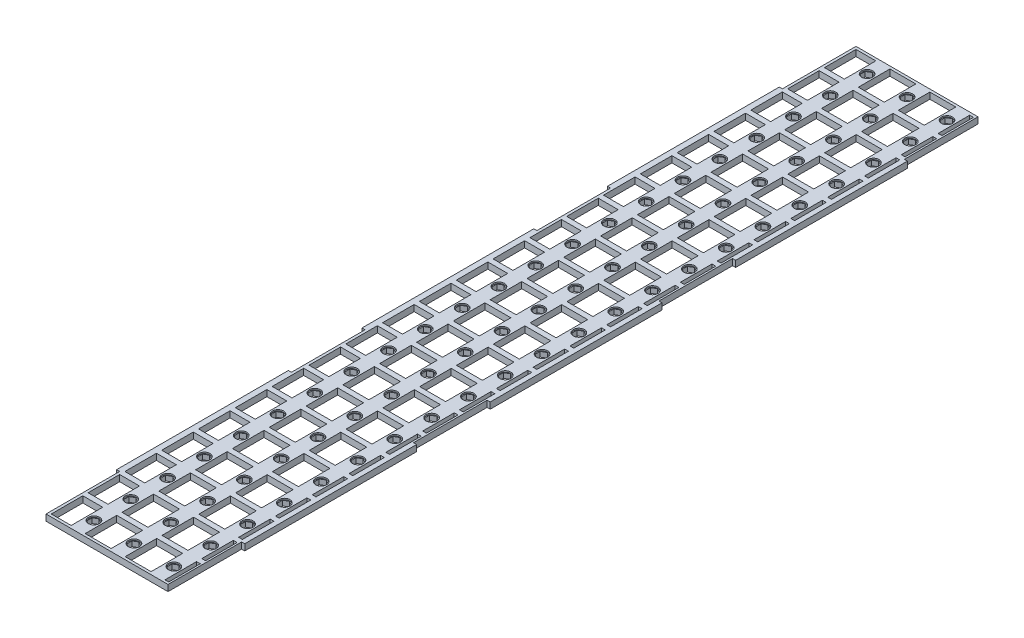
from build123d import *

# Parameters (mm, degrees)
SKETCH1_W            = 73.135680246
SKETCH1_H            = 461.99999802
BOSS_EXTRUDE1_DEPTH  = 3.571875
SKETCH2_R            = 3.175
CUT_EXTRUDE1_DEPTH   = 0.762
CUT_EXTRUDE2_REACH   = 235.904
LPATTERN1_COUNT      = 22
LPATTERN1_PITCH      = 21
LPATTERN1_COUNT_DIR2 = 3
LPATTERN1_PITCH_DIR2 = 22.8
CUT_EXTRUDE3_REACH   = 235.904
SKETCH5_W            = 14.8
SKETCH5_H            = 18
LPATTERN2_COUNT      = 22
LPATTERN2_PITCH      = 21
LPATTERN2_COUNT_DIR2 = 2
LPATTERN2_PITCH_DIR2 = 22.8
CUT_EXTRUDE4_REACH   = 235.904
SKETCH6_W            = 11.346000282
SKETCH6_H            = 18
LPATTERN3_COUNT      = 22
LPATTERN3_PITCH      = 21
CUT_EXTRUDE5_REACH   = 235.904
SKETCH7_W            = 1.76784
SKETCH7_H            = 42
LPATTERN4_COUNT      = 4
LPATTERN4_PITCH      = 139.99999934
LPATTERN4_COUNT_DIR2 = 2
LPATTERN4_PITCH_DIR2 = 71.367840246
CUT_EXTRUDE6_REACH   = 235.904
SKETCH8_W            = 2.15400216
SKETCH8_H            = 18
LPATTERN5_COUNT      = 4
LPATTERN5_PITCH      = 21
LPATTERN5_COL_COUNT  = 19
LPATTERN5_COL_PITCH  = 21


with BuildPart() as part:
    # Sketch1 → Boss-Extrude1 (new body)
    with BuildSketch(Plane(origin=(0, 0, 0), x_dir=(1, 0, 0), z_dir=(0, 1, 0))):
        Rectangle(SKETCH1_W, SKETCH1_H)
    extrude(amount=BOSS_EXTRUDE1_DEPTH)

    # Sketch2 → Cut-Extrude1 (cut)
    with BuildSketch(Plane(origin=(0, 3.571875, 0), x_dir=(1, 0, 0), z_dir=(0, 1, 0))):
        with Locations(Location((27.646000207, -220.49999901, 0), (0, 0, 270))):
            Circle(SKETCH2_R)
    cut_extrude1 = extrude(amount=-CUT_EXTRUDE1_DEPTH, mode=Mode.SUBTRACT)

    # Sketch4 → Cut-Extrude2 (cut, up to next)
    with BuildSketch(Plane(origin=(0, 3.571875, 0), x_dir=(1, 0, 0), z_dir=(0, 1, 0)), mode=Mode.PRIVATE) as cut_extrude2_sk1:
        Polygon((27.645899246, -223.478765553), (30.225637225, -221.989469717), (30.225738186, -219.010703173), (27.646101168, -217.521232467), (25.066363189, -219.010528303), (25.066262228, -221.989294847), align=None)
    cut_extrude2_tool1 = extrude(cut_extrude2_sk1.sketch, amount=-CUT_EXTRUDE2_REACH, mode=Mode.PRIVATE) & part.part
    cut_extrude2 = cut_extrude2_tool1.solids().sort_by_distance((27.646, 3.571875, 220.499999))[0]
    add(cut_extrude2, mode=Mode.SUBTRACT)

    # LPattern1: Cut-Extrude1, Cut-Extrude2 22 × 3
    with Locations(*[(-j * LPATTERN1_PITCH_DIR2, 0, -i * LPATTERN1_PITCH) for i in range(LPATTERN1_COUNT) for j in range(LPATTERN1_COUNT_DIR2) if (i, j) != (0, 0)]):
        add(cut_extrude1, mode=Mode.SUBTRACT)
        add(cut_extrude2, mode=Mode.SUBTRACT)

    # Sketch5 → Cut-Extrude3 (cut, up to next)
    with BuildSketch(Plane(origin=(0, 3.571875, 0), x_dir=(1, 0, 0), z_dir=(0, 1, 0)), mode=Mode.PRIVATE) as cut_extrude3_sk1:
        with Locations((16.246000207, -220.49999901)):
            Rectangle(SKETCH5_W, SKETCH5_H)
    cut_extrude3_tool1 = extrude(cut_extrude3_sk1.sketch, amount=-CUT_EXTRUDE3_REACH, mode=Mode.PRIVATE) & part.part
    cut_extrude3 = cut_extrude3_tool1.solids().sort_by_distance((16.246, 3.571875, 220.499999))[0]
    add(cut_extrude3, mode=Mode.SUBTRACT)

    # LPattern2: Cut-Extrude3 22 × 2
    with Locations(*[(-j * LPATTERN2_PITCH_DIR2, 0, -i * LPATTERN2_PITCH) for i in range(LPATTERN2_COUNT) for j in range(LPATTERN2_COUNT_DIR2) if (i, j) != (0, 0)]):
        add(cut_extrude3, mode=Mode.SUBTRACT)

    # Sketch6 → Cut-Extrude4 (cut, up to next)
    with BuildSketch(Plane(origin=(0, 3.571875, 0), x_dir=(1, 0, 0), z_dir=(0, 1, 0)), mode=Mode.PRIVATE) as cut_extrude4_sk1:
        with Locations((-27.626999934, -220.49999901)):
            Rectangle(SKETCH6_W, SKETCH6_H)
    cut_extrude4_tool1 = extrude(cut_extrude4_sk1.sketch, amount=-CUT_EXTRUDE4_REACH, mode=Mode.PRIVATE) & part.part
    cut_extrude4 = cut_extrude4_tool1.solids().sort_by_distance((-27.627, 3.571875, 220.499999))[0]
    add(cut_extrude4, mode=Mode.SUBTRACT)

    # LPattern3: Cut-Extrude4 ×22
    with Locations(*[(0, 0, -i * LPATTERN3_PITCH) for i in range(1, LPATTERN3_COUNT)]):
        add(cut_extrude4, mode=Mode.SUBTRACT)

    # Sketch7 → Cut-Extrude5 (cut, up to next)
    with BuildSketch(Plane(origin=(0, 3.571875, 0), x_dir=(1, 0, 0), z_dir=(0, 1, 0)), mode=Mode.PRIVATE) as cut_extrude5_sk1:
        with Locations((35.683920123, -209.99999901)):
            Rectangle(SKETCH7_W, SKETCH7_H)
    cut_extrude5_tool1 = extrude(cut_extrude5_sk1.sketch, amount=-CUT_EXTRUDE5_REACH, mode=Mode.PRIVATE) & part.part
    cut_extrude5 = cut_extrude5_tool1.solids().sort_by_distance((35.68392, 3.571875, 209.999999))[0]
    add(cut_extrude5, mode=Mode.SUBTRACT)

    # LPattern4: Cut-Extrude5 4 × 2
    with Locations(*[(-j * LPATTERN4_PITCH_DIR2, 0, -i * LPATTERN4_PITCH) for i in range(LPATTERN4_COUNT) for j in range(LPATTERN4_COUNT_DIR2) if (i, j) != (0, 0)]):
        add(cut_extrude5, mode=Mode.SUBTRACT)

    # Sketch8 → Cut-Extrude6 (cut, up to next)
    with BuildSketch(Plane(origin=(0, 3.571875, 0), x_dir=(1, 0, 0), z_dir=(0, 1, 0)), mode=Mode.PRIVATE) as cut_extrude6_sk1:
        with Locations((32.723001043, 157.412201024)):
            Rectangle(SKETCH8_W, SKETCH8_H)
    cut_extrude6_tool1 = extrude(cut_extrude6_sk1.sketch, amount=-CUT_EXTRUDE6_REACH, mode=Mode.PRIVATE) & part.part
    cut_extrude6 = cut_extrude6_tool1.solids().sort_by_distance((32.723001, 3.571875, -157.412201))[0]
    add(cut_extrude6, mode=Mode.SUBTRACT)

    # LPattern5: Cut-Extrude6 ×4
    with Locations(*[(0, 0, -i * LPATTERN5_PITCH) for i in range(1, LPATTERN5_COUNT)]):
        add(cut_extrude6, mode=Mode.SUBTRACT)

    # LPattern5 col: Cut-Extrude6 ×19
    with Locations(*[(0, 0, i * LPATTERN5_COL_PITCH) for i in range(1, LPATTERN5_COL_COUNT)]):
        add(cut_extrude6, mode=Mode.SUBTRACT)


solid = part.part
